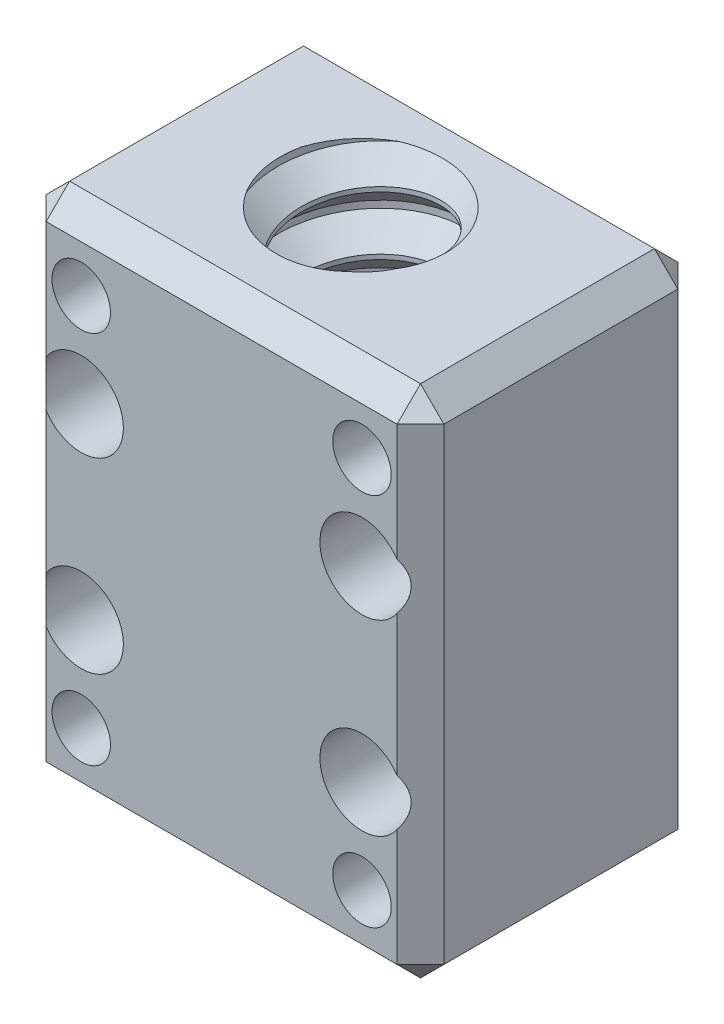
from build123d import *

# Parameters (mm, degrees)
SKETCH_1_W          = 17
SKETCH_1_H          = 22
EXTRUDE_1_DEPTH     = 12
CUT_EXTRUDE_1_REACH = 28.462
SKETCH_2_R          = 4
SWEEP_1_PITCH       = 2.5
SKETCH_7_R          = 15.483933968
CUT_EXTRUDE_3_DEPTH = 30
SKETCH_8_R          = 1.1
CUT_EXTRUDE_4_DEPTH = 19.364547541
SKETCH_9_R          = 1.8
CUT_EXTRUDE_5_DEPTH = 7
SKETCH_10_R         = 1.25
CUT_EXTRUDE_6_DEPTH = 7


with BuildPart() as part:
    # 草图1 → 凸台-拉伸1 (new body)
    with BuildSketch(Plane.XY):
        Rectangle(SKETCH_1_W, SKETCH_1_H)
    extrude(amount=EXTRUDE_1_DEPTH)

    # 草图2 → 切除-拉伸1 (cut, up to next)
    with BuildSketch(Plane.XZ.offset(11), mode=Mode.PRIVATE) as cut_extrude_1_sk1:
        with Locations(Location((0, 6, 0), (0, 0, 270))):
            Circle(SKETCH_2_R)
    cut_extrude_1_tool1 = extrude(cut_extrude_1_sk1.sketch, amount=-CUT_EXTRUDE_1_REACH, mode=Mode.PRIVATE) & part.part
    add(cut_extrude_1_tool1.solids().sort_by_distance((0, -11, 6))[0], mode=Mode.SUBTRACT)

    # 扫描1: the profile of 草图6 profile screwed along a left-hand helix of 9 turns, 10 arcs to a turn; built about Z, then put on its axis
    sweep_1_z = Axis((0, 0, 0), (0, 0, 1))
    sweep_1_corners = [(4.0003, 0, 2.2003), (4.0003, 0, -0.0003), (3, 0, 1), (3, 0, 1.2)]
    with BuildLine(mode=Mode.PRIVATE) as sweep_1_profile:
        Line(sweep_1_corners[0], sweep_1_corners[1])
        Line(sweep_1_corners[1], sweep_1_corners[2])
        Line(sweep_1_corners[2], sweep_1_corners[3])
        Line(sweep_1_corners[3], sweep_1_corners[0])
    sweep_1_cap = Face(sweep_1_profile.wire())
    sweep_1_turn_angles = [0, -18, -36, -54, -72, -90, -108, -126, -144, -162, -180, -198, -216, -234, -252, -270, -288, -306, -324, -342, -360]
    sweep_1_turn_weights = [1, 0.9510565162951535, 1, 0.9510565162951535, 1, 0.9510565162951535, 1, 0.9510565162951535, 1, 0.9510565162951535, 1, 0.9510565162951535, 1, 0.9510565162951535, 1, 0.9510565162951535, 1, 0.9510565162951535, 1, 0.9510565162951535, 1]
    sweep_1_turn_rails = [Edge.make_bspline([Vector(p[0], p[1], 0).rotate(sweep_1_z, sweep_1_turn_angles[k]) / sweep_1_turn_weights[k] + Vector(0, 0, p[2] + -SWEEP_1_PITCH * sweep_1_turn_angles[k] / 360) for k in range(21)], [0, 0, 0, 1, 1, 2, 2, 3, 3, 4, 4, 5, 5, 6, 6, 7, 7, 8, 8, 9, 9, 10, 10, 10], 2, sweep_1_turn_weights) for p in sweep_1_corners]
    sweep_1_turn_sides = [Face.make_surface_from_curves(sweep_1_turn_rails[p[0]], sweep_1_turn_rails[p[1]]) for p in [(0, 1), (1, 2), (2, 3), (3, 0)]]
    sweep_1 = Plane(origin=(0, -11, 6), x_dir=(0, 0, -1), z_dir=(0, 1, 0)) * Solid(Shell([*[p.moved(Location((0, 0, SWEEP_1_PITCH * i))) for i in range(9) for p in sweep_1_turn_sides], sweep_1_cap, sweep_1_cap.rotate(sweep_1_z, -3240).moved(Location((0, 0, -SWEEP_1_PITCH * -3240 / 360)))]))
    add(sweep_1)

    # 草图7 → 切除-拉伸3 (cut)
    with BuildSketch(Plane(origin=(0, 11, 0), x_dir=(1, 0, 0), z_dir=(0, 1, 0))):
        with Locations((0, -6)):
            Circle(SKETCH_7_R)
    extrude(amount=CUT_EXTRUDE_3_DEPTH, mode=Mode.SUBTRACT)

    # 草图8 → 切除-拉伸4 (cut, through all)
    with BuildSketch(Plane.XY.offset(12)):
        with Locations((6, 4)):
            Circle(SKETCH_8_R)
        with Locations(Location((-6, 4, 0), (0, 0, 180))):
            Circle(SKETCH_8_R)
        with Locations((-6, -4)):
            Circle(SKETCH_8_R)
        with Locations(Location((6, -4, 0), (0, 0, 180))):
            Circle(SKETCH_8_R)
    extrude(amount=-CUT_EXTRUDE_4_DEPTH, mode=Mode.SUBTRACT)

    # 草图9 → 切除-拉伸5 (cut)
    with BuildSketch(Plane.XY.offset(12)):
        with Locations((-6, 4)):
            Circle(SKETCH_9_R)
        with Locations((6, 4)):
            Circle(SKETCH_9_R)
        with Locations((6, -4)):
            Circle(SKETCH_9_R)
        with Locations((-6, -4)):
            Circle(SKETCH_9_R)
    extrude(amount=-CUT_EXTRUDE_5_DEPTH, mode=Mode.SUBTRACT)

    # 草图10 → 切除-拉伸6 (cut)
    with BuildSketch(Plane.XY.offset(12)):
        with Locations((6, 8)):
            Circle(SKETCH_10_R)
        with Locations(Location((-6, 8, 0), (0, 0, 180))):
            Circle(SKETCH_10_R)
        with Locations(Location((6, -8, 0), (0, 0, 180))):
            Circle(SKETCH_10_R)
        with Locations((-6, -8)):
            Circle(SKETCH_10_R)
    extrude(amount=-CUT_EXTRUDE_6_DEPTH, mode=Mode.SUBTRACT)

    # Chamfer 1
    # the kernel refuses this chamfer: 1 mm, written as the material it takes off along each edge
    with BuildSketch(Plane(origin=(-7.833333333, 10.333333333, 11.333333333), x_dir=(-0.7071067811865475, -0.7071067811865475, 0), z_dir=(-0.5773502691896258, 0.5773502691896258, 0.5773502691896258)), Plane(origin=(7.833333333, 10.333333333, 11.333333333), x_dir=(0, -0.7071067811865475, 0.7071067811865475), z_dir=(0.5773502691896258, 0.5773502691896258, 0.5773502691896258)), Plane(origin=(-7.833333333, -10.333333333, 0.666666667), x_dir=(-0.7071067811865475, 0.7071067811865475, 0), z_dir=(-0.5773502691896257, -0.5773502691896257, -0.5773502691896258)), Plane(origin=(7.833333333, -10.333333333, 0.666666667), x_dir=(0, 0.7071067811865476, -0.7071067811865475), z_dir=(0.5773502691896257, -0.5773502691896257, -0.5773502691896258))) as chamfer_1_piece_1:
        Polygon((-0.707106781, -0.40824829), (0.707106781, -0.40824829), (0, 0.816496581), align=None)
    extrude(amount=1.270170592, mode=Mode.SUBTRACT)
    with BuildSketch(Plane(origin=(-7.833333333, -10.333333333, 11.333333333), x_dir=(-0.7071067811865475, 0.7071067811865475, 0), z_dir=(-0.5773502691896258, -0.5773502691896258, 0.5773502691896258)), Plane(origin=(7.833333333, -10.333333333, 11.333333333), x_dir=(0, 0.7071067811865475, 0.7071067811865475), z_dir=(0.5773502691896258, -0.5773502691896258, 0.5773502691896258)), Plane(origin=(-7.833333333, 10.333333333, 0.666666667), x_dir=(-0.7071067811865475, -0.7071067811865475, 0), z_dir=(-0.5773502691896257, 0.5773502691896257, -0.5773502691896258)), Plane(origin=(7.833333333, 10.333333333, 0.666666667), x_dir=(0, -0.7071067811865476, -0.7071067811865475), z_dir=(0.5773502691896257, 0.5773502691896257, -0.5773502691896258))) as chamfer_1_piece_2:
        Polygon((-0.707106781, 0.40824829), (0.707106781, 0.40824829), (0, -0.816496581), align=None)
    extrude(amount=1.270170592, mode=Mode.SUBTRACT)
    with BuildSketch(Plane(origin=(-8.5, 13.571682988, 12), x_dir=(-0.027495876610585647, 0, -0.9996219169112968), z_dir=(0, -1, 0)), Plane(origin=(8.5, -13.571682988, 0), x_dir=(-0.9996219169112968, 0, -0.027495876610586365), z_dir=(0, 1, 0))) as chamfer_1_piece_3:
        with BuildLine():
            Line((1.028673195, 0), (-0.056547155, 1.027117794))
            Line((-0.056547155, 1.027117794), (-0.076539593, 1.026567876))
            ThreePointArc((-0.076539593, 1.026567876), (-0.034129227, 0.51339783), (-0.019992438, -0.000549918))
            Line((-0.019992438, -0.000549918), (0.000549918, -0.019992438))
            ThreePointArc((0.000549918, -0.019992438), (0.514497665, -0.00585565), (1.029223113, -0.019992438))
            Line((1.029223113, -0.019992438), (1.028673195, 0))
        make_face()
    extrude(amount=27.143365976, mode=Mode.SUBTRACT)
    with BuildSketch(Plane(origin=(-11.071682988, -11, 12), x_dir=(0, -0.027495876610585647, -0.9996219169112968), z_dir=(1, 0, 0)), Plane(origin=(11.071682988, 11, 0), x_dir=(0, -0.9996219169112968, -0.02749587661058639), z_dir=(-1, 0, 0))) as chamfer_1_piece_4:
        with BuildLine():
            Line((1.028673195, 0), (-0.056547155, 1.027117794))
            Line((-0.056547155, 1.027117794), (-0.076539593, 1.026567876))
            ThreePointArc((-0.076539593, 1.026567876), (-0.034129227, 0.51339783), (-0.019992438, -0.000549918))
            Line((-0.019992438, -0.000549918), (0.000549918, -0.019992438))
            ThreePointArc((0.000549918, -0.019992438), (0.514497665, -0.00585565), (1.029223113, -0.019992438))
            Line((1.029223113, -0.019992438), (1.028673195, 0))
        make_face()
    extrude(amount=22.143365976, mode=Mode.SUBTRACT)
    with BuildSketch(Plane(origin=(8.5, -13.571682988, 12), x_dir=(-0.9996219169112968, 0, 0.027495876610585623), z_dir=(0, 1, 0)), Plane(origin=(-8.5, 13.571682988, 0), x_dir=(-0.02749587661058563, 0, 0.9996219169112968), z_dir=(0, -1, 0))) as chamfer_1_piece_5:
        with BuildLine():
            Line((1.028673195, 0), (-0.056547155, -1.027117794))
            Line((-0.056547155, -1.027117794), (-0.076539593, -1.026567876))
            ThreePointArc((-0.076539593, -1.026567876), (-0.034129227, -0.51339783), (-0.019992438, 0.000549918))
            Line((-0.019992438, 0.000549918), (0.000549918, 0.019992438))
            ThreePointArc((0.000549918, 0.019992438), (0.514497665, 0.00585565), (1.029223113, 0.019992438))
            Line((1.029223113, 0.019992438), (1.028673195, 0))
        make_face()
    extrude(amount=27.143365976, mode=Mode.SUBTRACT)
    with BuildSketch(Plane(origin=(-11.071682988, -11, 0), x_dir=(0, -0.02749587661058563, 0.9996219169112968), z_dir=(1, 0, 0)), Plane(origin=(11.071682988, 11, 12), x_dir=(0, -0.9996219169112968, 0.027495876610585647), z_dir=(-1, 0, 0))) as chamfer_1_piece_6:
        with BuildLine():
            Line((1.028673195, 0), (-0.056547155, -1.027117794))
            Line((-0.056547155, -1.027117794), (-0.076539593, -1.026567876))
            ThreePointArc((-0.076539593, -1.026567876), (-0.034129227, -0.51339783), (-0.019992438, 0.000549918))
            Line((-0.019992438, 0.000549918), (0.000549918, 0.019992438))
            ThreePointArc((0.000549918, 0.019992438), (0.514497665, 0.00585565), (1.029223113, 0.019992438))
            Line((1.029223113, 0.019992438), (1.028673195, 0))
        make_face()
    extrude(amount=22.143365976, mode=Mode.SUBTRACT)
    with BuildSketch(Plane(origin=(8.5, -11, -2.571682988), x_dir=(-0.9996219169112968, -0.027495876610585623, 0), z_dir=(0, 0, 1)), Plane(origin=(8.5, 11, -2.571682988), x_dir=(0.027495876610585647, -0.9996219169112968, 0), z_dir=(0, 0, 1))) as chamfer_1_piece_7:
        with BuildLine():
            Line((1.028673195, 0), (-0.056547155, -1.027117794))
            Line((-0.056547155, -1.027117794), (-0.076539593, -1.026567876))
            ThreePointArc((-0.076539593, -1.026567876), (-0.034129227, -0.51339783), (-0.019992438, 0.000549918))
            Line((-0.019992438, 0.000549918), (0.000549918, 0.019992438))
            ThreePointArc((0.000549918, 0.019992438), (0.514497665, 0.00585565), (1.029223113, 0.019992438))
            Line((1.029223113, 0.019992438), (1.028673195, 0))
        make_face()
    extrude(amount=17.143365976, mode=Mode.SUBTRACT)
    with BuildSketch(Plane(origin=(-8.5, -11, -2.571682988), x_dir=(0.9996219169112968, -0.027495876610585623, 0), z_dir=(0, 0, 1)), Plane(origin=(-8.5, 11, -2.571682988), x_dir=(-0.027495876610585647, -0.9996219169112968, 0), z_dir=(0, 0, 1))) as chamfer_1_piece_8:
        with BuildLine():
            Line((1.028673195, 0), (-0.056547155, 1.027117794))
            Line((-0.056547155, 1.027117794), (-0.076539593, 1.026567876))
            ThreePointArc((-0.076539593, 1.026567876), (-0.034129227, 0.51339783), (-0.019992438, -0.000549918))
            Line((-0.019992438, -0.000549918), (0.000549918, -0.019992438))
            ThreePointArc((0.000549918, -0.019992438), (0.514497665, -0.00585565), (1.029223113, -0.019992438))
            Line((1.029223113, -0.019992438), (1.028673195, 0))
        make_face()
    extrude(amount=17.143365976, mode=Mode.SUBTRACT)


solid = part.part
